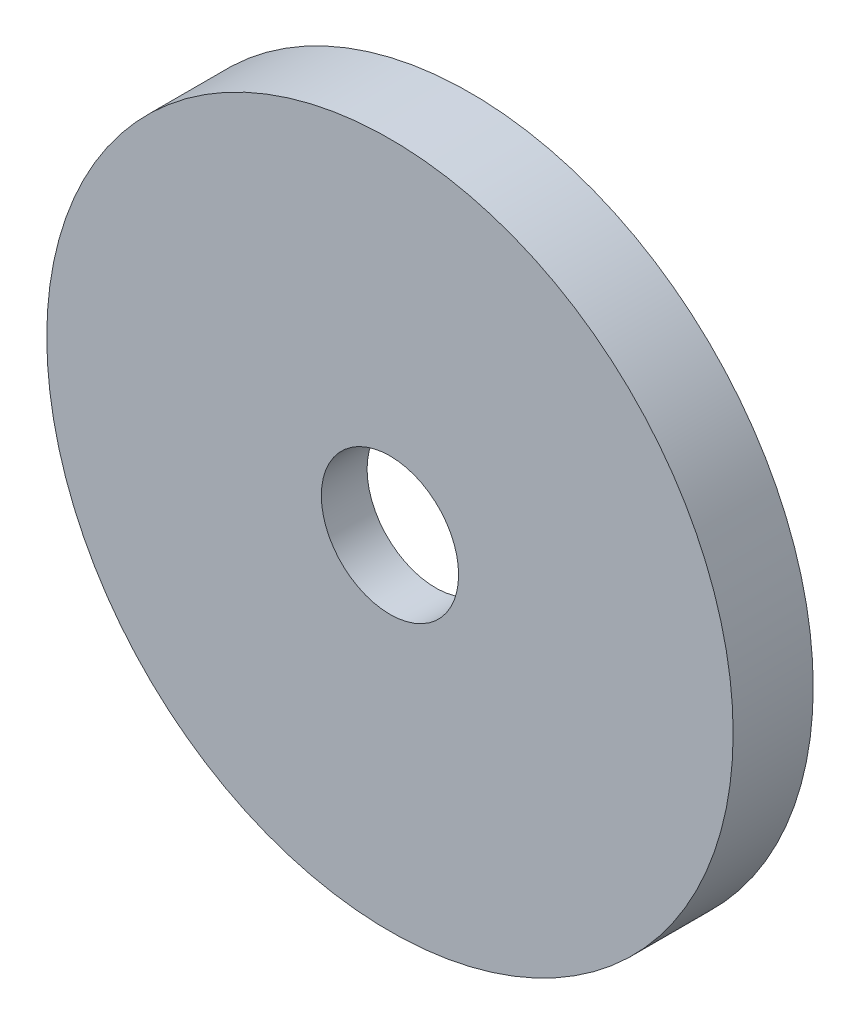
from build123d import *

# Parameters (mm, degrees)
SKETCH2_R           = 30
BOSS_EXTRUDE1_DEPTH = 6
SKETCH3_R           = 8
CUT_EXTRUDE1_DEPTH  = 2
SKETCH5_R           = 30
SKETCH5_R_2         = 8
CUT_EXTRUDE3_DEPTH  = 2
BOSS_EXTRUDE3_START = 3
SKETCH7_R           = 30
SKETCH7_R_2         = 20
BOSS_EXTRUDE3_DEPTH = 3
SKETCH4_R           = 6
CUT_EXTRUDE4_DEPTH  = 10


with BuildPart() as part:
    # Sketch2 → Boss-Extrude1 (new body)
    with BuildSketch(Plane.XY):
        Circle(SKETCH2_R)
    extrude(amount=BOSS_EXTRUDE1_DEPTH)

    # Sketch3 → Cut-Extrude1 (cut)
    with BuildSketch(Plane(origin=(0, 0, 0), x_dir=(-1, 0, 0), z_dir=(0, 0, -1))):
        Circle(SKETCH3_R)
    extrude(amount=-CUT_EXTRUDE1_DEPTH, mode=Mode.SUBTRACT)

    # Sketch5 → Cut-Extrude3 (cut)
    with BuildSketch(Plane(origin=(0, 0, 0), x_dir=(-1, 0, 0), z_dir=(0, 0, -1))):
        Circle(SKETCH5_R)
        Circle(SKETCH5_R_2, mode=Mode.SUBTRACT)
    extrude(amount=-CUT_EXTRUDE3_DEPTH, mode=Mode.SUBTRACT)

    # Sketch7 → Boss-Extrude3 (add)
    with BuildSketch(Plane(origin=(0, 0, 2), x_dir=(-1, 0, 0), z_dir=(0, 0, -1)).offset(BOSS_EXTRUDE3_START)):
        Circle(SKETCH7_R)
        Circle(SKETCH7_R_2, mode=Mode.SUBTRACT)
    extrude(amount=-BOSS_EXTRUDE3_DEPTH)

    # Sketch4 → Cut-Extrude4 (cut)
    with BuildSketch(Plane(origin=(0, 0, 2), x_dir=(-1, 0, 0), z_dir=(0, 0, -1))):
        Circle(SKETCH4_R)
    extrude(amount=-CUT_EXTRUDE4_DEPTH, mode=Mode.SUBTRACT)


solid = part.part
